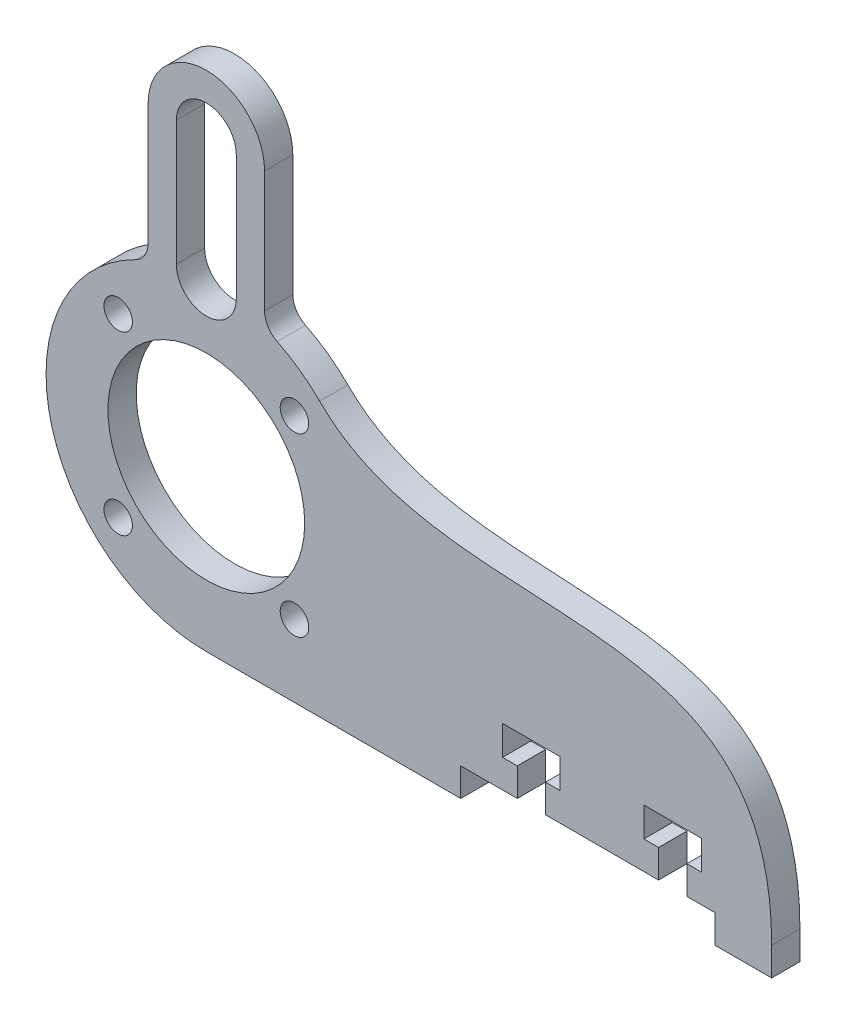
from build123d import *

# Parameters (mm, degrees)
SKETCH1_R           = 11.049
SKETCH1_R_2         = 1.6
BOSS_EXTRUDE1_DEPTH = 3.175


with BuildPart() as part:
    # Sketch1 → Boss-Extrude1 (new body)
    with BuildSketch(Plane.XY):
        with BuildLine():
            Line((57.15, -17.99971), (63.5, -17.99971))
            Line((63.5, -17.99971), (63.5, -14.82471))
            add(Edge.make_bspline(
                [(12.727717, 12.727717), (27.423563492, -1.968129491), (63.5, 17.247065153), (63.5, -14.82471)],
                knots=[0, 0, 0, 0, 1, 1, 1, 1], degree=3))
            ThreePointArc((12.727717, 12.727717), (10.482848551, 14.632137449), (7.957579082, 16.145169409))
            ThreePointArc((7.957579082, 16.145169409), (6.92367141, 17.081943495), (6.5405, 18.423468909))
            Line((6.5405, 18.423468909), (6.5405, 32.009359553))
            ThreePointArc((6.5405, 32.009359553), (0, 38.549859553), (-6.5405, 32.009359553))
            Line((-6.5405, 32.009359553), (-6.5405, 18.423468909))
            ThreePointArc((-6.5405, 18.423468909), (-6.92367141, 17.081943495), (-7.957579082, 16.145169409))
            ThreePointArc((-7.957579082, 16.145169409), (-17.529944771, -4.085412637), (0, -17.99971))
            Line((0, -17.99971), (28.575, -17.99971))
            Line((28.575, -17.99971), (28.575, -14.82471))
            Line((28.575, -14.82471), (34.925, -14.82471))
            Line((34.925, -14.82471), (34.925, -11.64971))
            Line((34.925, -11.64971), (33.274, -11.64971))
            Line((33.274, -11.64971), (33.274, -8.34771))
            Line((33.274, -8.34771), (39.751, -8.34771))
            Line((39.751, -8.34771), (39.751, -11.64971))
            Line((39.751, -11.64971), (38.1, -11.64971))
            Line((38.1, -11.64971), (38.1, -14.82471))
            Line((38.1, -14.82471), (50.8, -14.82471))
            Line((50.8, -14.82471), (50.8, -11.64971))
            Line((50.8, -11.64971), (49.149, -11.64971))
            Line((49.149, -11.64971), (49.149, -8.34771))
            Line((49.149, -8.34771), (55.626, -8.34771))
            Line((55.626, -8.34771), (55.626, -11.64971))
            Line((55.626, -11.64971), (53.975, -11.64971))
            Line((53.975, -11.64971), (53.975, -14.82471))
            Line((53.975, -14.82471), (57.15, -14.82471))
            Line((57.15, -14.82471), (57.15, -17.99971))
        make_face()
        Circle(SKETCH1_R, mode=Mode.SUBTRACT)
        with Locations((9.899834348, 9.899834348)):
            Circle(SKETCH1_R_2, mode=Mode.SUBTRACT)
        with Locations((9.899834348, -9.899834348)):
            Circle(SKETCH1_R_2, mode=Mode.SUBTRACT)
        with Locations((-9.899834348, -9.899834348)):
            Circle(SKETCH1_R_2, mode=Mode.SUBTRACT)
        with Locations((-9.899834348, 9.899834348)):
            Circle(SKETCH1_R_2, mode=Mode.SUBTRACT)
        with BuildLine():
            Line((3.3655, 32.009359553), (3.3655, 17.99971))
            ThreePointArc((3.3655, 17.99971), (0, 14.63421), (-3.3655, 17.99971))
            Line((-3.3655, 17.99971), (-3.3655, 32.009359553))
            ThreePointArc((-3.3655, 32.009359553), (0, 35.374859553), (3.3655, 32.009359553))
        make_face(mode=Mode.SUBTRACT)
    extrude(amount=BOSS_EXTRUDE1_DEPTH)


solid = part.part
